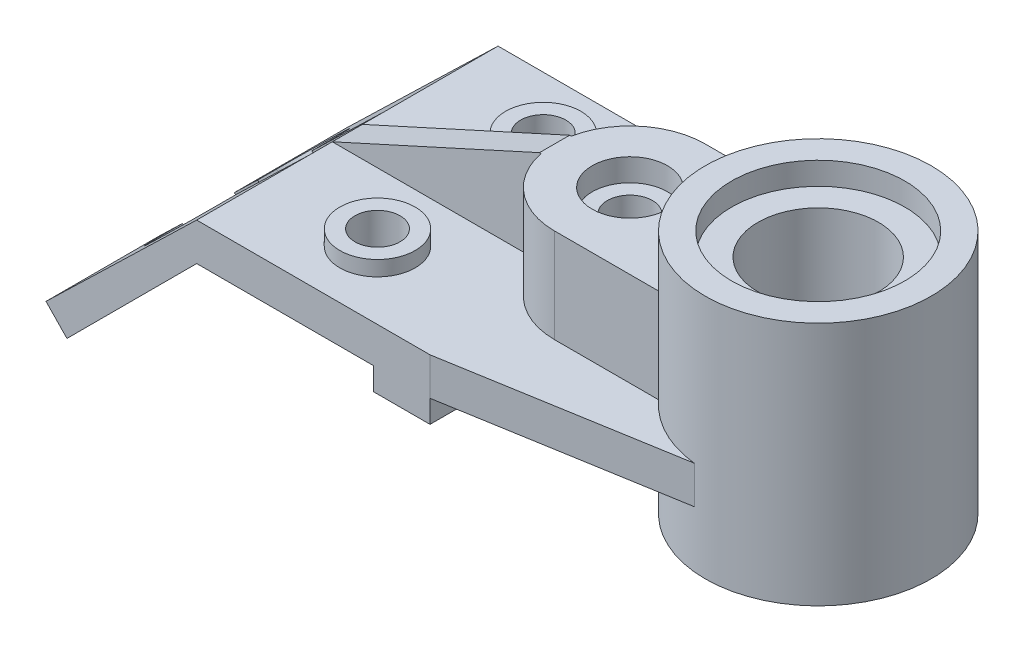
from build123d import *

# Parameters (mm, degrees)
SKETCH2_R                 = 30
BOSS_EXTRUDE2_DEPTH       = 65
SKETCH4_R                 = 23
CUT_EXTRUDE1_DEPTH        = 6
SKETCH5_R                 = 16
CUT_EXTRUDE2_DEPTH        = 110
BOSS_EXTRUDE4_DEPTH       = 10
BOSS_EXTRUDE5_DEPTH       = 25
SKETCH13_R                = 10
CUT_EXTRUDE3_DEPTH        = 6
SKETCH14_R                = 6
CUT_EXTRUDE4_DEPTH        = 35
SKETCH15_R                = 10
BOSS_EXTRUDE6_DEPTH       = 4
SKETCH16_R                = 6
CUT_EXTRUDE5_DEPTH        = 24
SKETCH17_R                = 6
CUT_EXTRUDE6_DEPTH        = 24
BOSS_EXTRUDE10_DEPTH      = 4
BOSS_EXTRUDE10_DEPTH_BACK = 4
BOSS_EXTRUDE11_DEPTH      = 80
CUT_EXTRUDE7_DEPTH        = 80
SKETCH26_W                = 55.348835227
SKETCH26_H                = 20
CUT_EXTRUDE8_DEPTH        = 2
SKETCH28_W                = 15
SKETCH28_H                = 6
BOSS_EXTRUDE14_DEPTH      = 80


with BuildPart() as part:
    # Sketch2 → Boss-Extrude2 (new body)
    with BuildSketch(Plane(origin=(0, 0, 0), x_dir=(1, 0, 0), z_dir=(0, 1, 0))):
        with Locations((-8.519964016, 5.291408553)):
            Circle(SKETCH2_R)
    extrude(amount=BOSS_EXTRUDE2_DEPTH)

    # Sketch4 → Cut-Extrude1 (cut)
    with BuildSketch(Plane(origin=(0, 65, 0), x_dir=(1, 0, 0), z_dir=(0, 1, 0))):
        with Locations((-8.519964016, 5.291408553)):
            Circle(SKETCH4_R)
    extrude(amount=-CUT_EXTRUDE1_DEPTH, mode=Mode.SUBTRACT)

    # Sketch5 → Cut-Extrude2 (cut)
    with BuildSketch(Plane(origin=(0, 59, 0), x_dir=(1, 0, 0), z_dir=(0, 1, 0))):
        with Locations((-8.519964016, 5.291408553)):
            Circle(SKETCH5_R)
    extrude(amount=-CUT_EXTRUDE2_DEPTH, mode=Mode.SUBTRACT)

    # Sketch11 → Boss-Extrude4 (add)
    with BuildSketch(Plane(origin=(0, 15, 0), x_dir=(1, 0, 0), z_dir=(0, 1, 0))):
        with BuildLine():
            Line((-11.573258006, 35.135627354), (-71.573258006, 45.291408553))
            Line((-71.573258006, 45.291408553), (-133.519964016, 45.291408553))
            Line((-133.519964016, 45.291408553), (-133.519964016, -34.708591447))
            Line((-133.519964016, -34.708591447), (-71.573258006, -34.708591447))
            Line((-71.573258006, -34.708591447), (-11.573258006, -24.552810247))
            ThreePointArc((-11.573258006, -24.552810247), (-38.519964016, 5.291408553), (-11.573258006, 35.135627354))
        make_face()
    extrude(amount=BOSS_EXTRUDE4_DEPTH)

    # Sketch12 → Boss-Extrude5 (add)
    with BuildSketch(Plane(origin=(0, 25, 0), x_dir=(1, 0, 0), z_dir=(0, 1, 0))):
        with BuildLine():
            Line((-58.519964016, 25.291408553), (-30.880643791, 25.291408553))
            Line((-30.880643791, 25.291408553), (-30.880643791, -14.708591447))
            Line((-30.880643791, -14.708591447), (-58.519964016, -14.708591447))
            ThreePointArc((-58.519964016, -14.708591447), (-78.519964016, 5.291408553), (-58.519964016, 25.291408553))
        make_face()
    extrude(amount=BOSS_EXTRUDE5_DEPTH)

    # Sketch13 → Cut-Extrude3 (cut)
    with BuildSketch(Plane(origin=(0, 50, 0), x_dir=(1, 0, 0), z_dir=(0, 1, 0))):
        with Locations((-58.519964016, 5.291408553)):
            Circle(SKETCH13_R)
    extrude(amount=-CUT_EXTRUDE3_DEPTH, mode=Mode.SUBTRACT)

    # Sketch14 → Cut-Extrude4 (cut)
    with BuildSketch(Plane(origin=(0, 44, 0), x_dir=(1, 0, 0), z_dir=(0, 1, 0))):
        with Locations((-58.519964016, 5.291408553)):
            Circle(SKETCH14_R)
    extrude(amount=-CUT_EXTRUDE4_DEPTH, mode=Mode.SUBTRACT)

    # Sketch15 → Boss-Extrude6 (add)
    with BuildSketch(Plane(origin=(0, 25, 0), x_dir=(1, 0, 0), z_dir=(0, 1, 0))):
        with Locations((-103.519964016, 27.291408553)):
            Circle(SKETCH15_R)
        with Locations((-103.519964016, -16.708591447)):
            Circle(SKETCH15_R)
    extrude(amount=BOSS_EXTRUDE6_DEPTH)

    # Sketch16 → Cut-Extrude5 (cut)
    with BuildSketch(Plane(origin=(0, 29, 0), x_dir=(1, 0, 0), z_dir=(0, 1, 0))):
        with Locations((-103.519964016, 27.291408553)):
            Circle(SKETCH16_R)
    extrude(amount=-CUT_EXTRUDE5_DEPTH, mode=Mode.SUBTRACT)

    # Sketch17 → Cut-Extrude6 (cut)
    with BuildSketch(Plane(origin=(0, 29, 0), x_dir=(1, 0, 0), z_dir=(0, 1, 0))):
        with Locations((-103.519964016, -16.708591447)):
            Circle(SKETCH17_R)
    extrude(amount=-CUT_EXTRUDE6_DEPTH, mode=Mode.SUBTRACT)

    # Sketch22 → Boss-Extrude10 (add, two sides: drawn at the far end of the back side and taken through both)
    with BuildSketch(Plane.XY.offset(-5.291408553).offset(-BOSS_EXTRUDE10_DEPTH_BACK)):
        Polygon((-133.519964016, 25), (-78.519964016, 50), (-68.519964016, 50), (-68.519964016, 25), align=None)
    extrude(amount=BOSS_EXTRUDE10_DEPTH + BOSS_EXTRUDE10_DEPTH_BACK)

    # Sketch24 → Boss-Extrude11 (add)
    with BuildSketch(Plane.XY.offset(34.708591447)):
        Polygon((-133.519964016, 25), (-173.519964016, -13.687864131), (-167.958212145, -19.438248129), (-133.519964016, 15), align=None)
    extrude(amount=-BOSS_EXTRUDE11_DEPTH)

    # Sketch25 → Cut-Extrude7 (cut)
    with BuildSketch(Plane(origin=(-77.02717921, 79.639629574, 0), x_dir=(0.7187979997940912, 0.6952189838403534, 0), z_dir=(-0.6952189838403535, 0.7187979997940913, 0))):
        with BuildLine():
            Line((-105.606502534, 20.291408553), (-105.606502534, -9.708591447))
            ThreePointArc((-105.606502534, -9.708591447), (-115.606502534, -19.708591447), (-125.606502534, -9.708591447))
            Line((-125.606502534, -9.708591447), (-125.606502534, 20.291408553))
            ThreePointArc((-125.606502534, 20.291408553), (-115.606502534, 30.291408553), (-105.606502534, 20.291408553))
        make_face()
    extrude(amount=-CUT_EXTRUDE7_DEPTH, mode=Mode.SUBTRACT)

    # Sketch26 → Cut-Extrude8 (cut)
    with BuildSketch(Plane(origin=(-77.02717921, 79.639629574, 0), x_dir=(0.7187979997940912, 0.6952189838403534, 0), z_dir=(-0.6952189838403535, 0.7187979997940913, 0))):
        with Locations((-106.567448438, 5.291408553)):
            Rectangle(SKETCH26_W, SKETCH26_H)
    extrude(amount=-CUT_EXTRUDE8_DEPTH, mode=Mode.SUBTRACT)

    # Sketch28 → Boss-Extrude14 (add)
    with BuildSketch(Plane.XY.offset(34.708591447)):
        with Locations((-79.073258006, 12)):
            Rectangle(SKETCH28_W, SKETCH28_H)
    extrude(amount=-BOSS_EXTRUDE14_DEPTH)


solid = part.part
